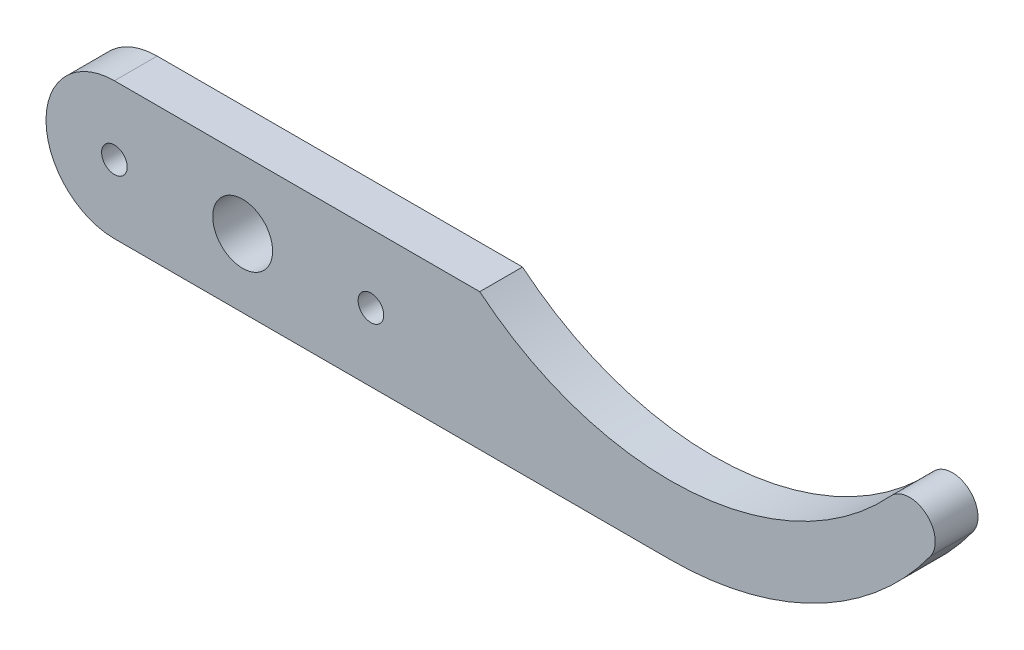
from build123d import *

# Parameters (mm, degrees)
ESQUISSE1_R        = 1.5
ESQUISSE1_R_2      = 3.5
BOSS_EXTRU_1_DEPTH = 5


with BuildPart() as part:
    # Esquisse1 → Boss.-Extru.1 (new body)
    with BuildSketch(Plane.XY):
        with BuildLine():
            Line((0, 8), (20, 8))
            Line((20, 8), (27.728942549, 8))
            ThreePointArc((27.728942549, 8), (52.424855188, 0.084099935), (75.789473684, 11.33772946))
            ThreePointArc((75.789473684, 11.33772946), (79.896044345, 11.634403837), (80.431323149, 7.552074247))
            ThreePointArc((80.431323149, 7.552074247), (67.087513292, -3.886684877), (50, -8))
            Line((50, -8), (0, -8))
            Line((0, -8), (-15, -8))
            ThreePointArc((-15, -8), (-23, 0), (-15, 8))
            Line((-15, 8), (0, 8))
        make_face()
        with Locations((15, 0)):
            Circle(ESQUISSE1_R, mode=Mode.SUBTRACT)
        with Locations((-15, 0)):
            Circle(ESQUISSE1_R, mode=Mode.SUBTRACT)
        Circle(ESQUISSE1_R_2, mode=Mode.SUBTRACT)
    extrude(amount=BOSS_EXTRU_1_DEPTH)


solid = part.part
